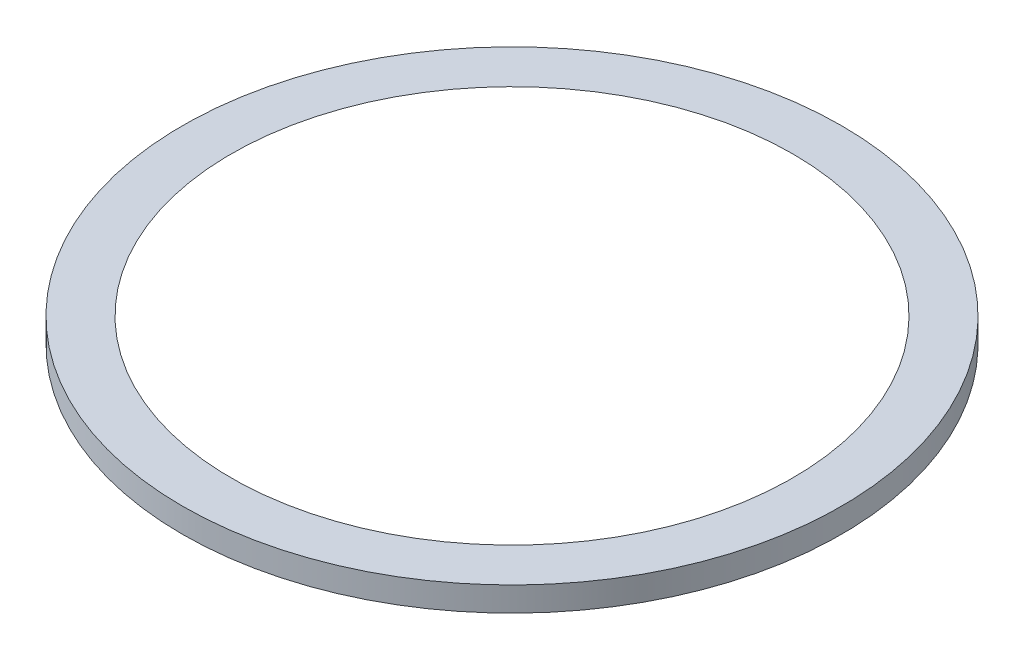
from build123d import *

# Parameters (mm, degrees)
SKETCH1_R           = 13.5
SKETCH1_R_2         = 11.5
BOSS_EXTRUDE1_DEPTH = 1


with BuildPart() as part:
    # Sketch1 → Boss-Extrude1 (new body)
    with BuildSketch(Plane(origin=(0, 0, 0), x_dir=(1, 0, 0), z_dir=(0, 1, 0))):
        Circle(SKETCH1_R)
        Circle(SKETCH1_R_2, mode=Mode.SUBTRACT)
    extrude(amount=BOSS_EXTRUDE1_DEPTH)

    # Sketch2 → Cut-Revolve1 (revolve, cut)
    with BuildSketch(Plane(origin=(0, 0, 0), x_dir=(0, 0, -1), z_dir=(1, 0, 0))):
        Polygon((-11.5, 1), (-13.293422916, 0), (-11.5, 0), align=None)
    revolve(axis=Axis((0, -2.060833688, 0), (0, 1, 0)), mode=Mode.SUBTRACT)


solid = part.part
